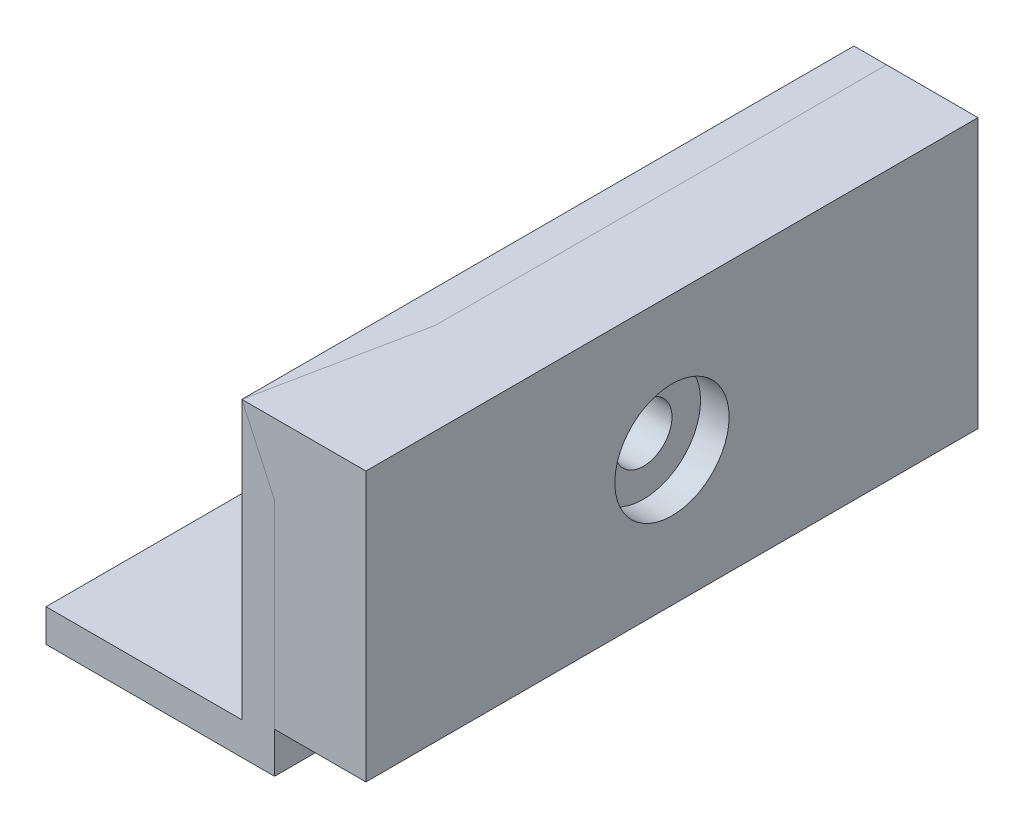
from build123d import *

# Parameters (mm, degrees)
SKETCH1_W           = 75
SKETCH1_H           = 33
SKETCH1_R           = 3.5
BOSS_EXTRUDE1_DEPTH = 11.2
SKETCH2_R           = 7
CUT_EXTRUDE1_DEPTH  = 3.5
BOSS_EXTRUDE2_START = 4
SKETCH3_W           = 75
SKETCH3_H           = 33
SKETCH3_R           = 3.5
BOSS_EXTRUDE2_DEPTH = 4
SKETCH3_3_W         = 75
SKETCH3_3_H         = 38
SKETCH3_3_R         = 3.5
BOSS_EXTRUDE4_DEPTH = 4
SKETCH6_W           = 75
SKETCH6_H           = 4.002033335
BOSS_EXTRUDE6_DEPTH = 24


with BuildPart() as part:
    # Sketch1 → Boss-Extrude1 (new body)
    with BuildSketch(Plane(origin=(0, 0, 0), x_dir=(0, 0, -1), z_dir=(1, 0, 0))):
        Rectangle(SKETCH1_W, SKETCH1_H)
        Circle(SKETCH1_R, mode=Mode.SUBTRACT)
    extrude(amount=BOSS_EXTRUDE1_DEPTH)

    # Sketch2 → Cut-Extrude1 (cut)
    with BuildSketch(Plane(origin=(11.2, 0, 0), x_dir=(0, 0, -1), z_dir=(1, 0, 0))):
        Circle(SKETCH2_R)
    extrude(amount=-CUT_EXTRUDE1_DEPTH, mode=Mode.SUBTRACT)

    # Sketch3 → Boss-Extrude2 (add)
    with BuildSketch(Plane.ZY.offset(BOSS_EXTRUDE2_START)):
        Rectangle(SKETCH3_W, SKETCH3_H)
        Circle(SKETCH3_R, mode=Mode.SUBTRACT)
    extrude(amount=-BOSS_EXTRUDE2_DEPTH)


with BuildPart() as body_2:
    # Sketch3<3> → Boss-Extrude4 (new body)
    with BuildSketch(Plane.ZY):
        with Locations((0, -2.5)):
            Rectangle(SKETCH3_3_W, SKETCH3_3_H)
        Circle(SKETCH3_3_R, mode=Mode.SUBTRACT)
    extrude(amount=BOSS_EXTRUDE4_DEPTH)

    # Sketch6 → Boss-Extrude6 (add)
    with BuildSketch(Plane.ZY.offset(4)):
        with Locations((0, -19.498983332)):
            Rectangle(SKETCH6_W, SKETCH6_H)
    extrude(amount=BOSS_EXTRUDE6_DEPTH)


solid = Compound([part.part, body_2.part])
